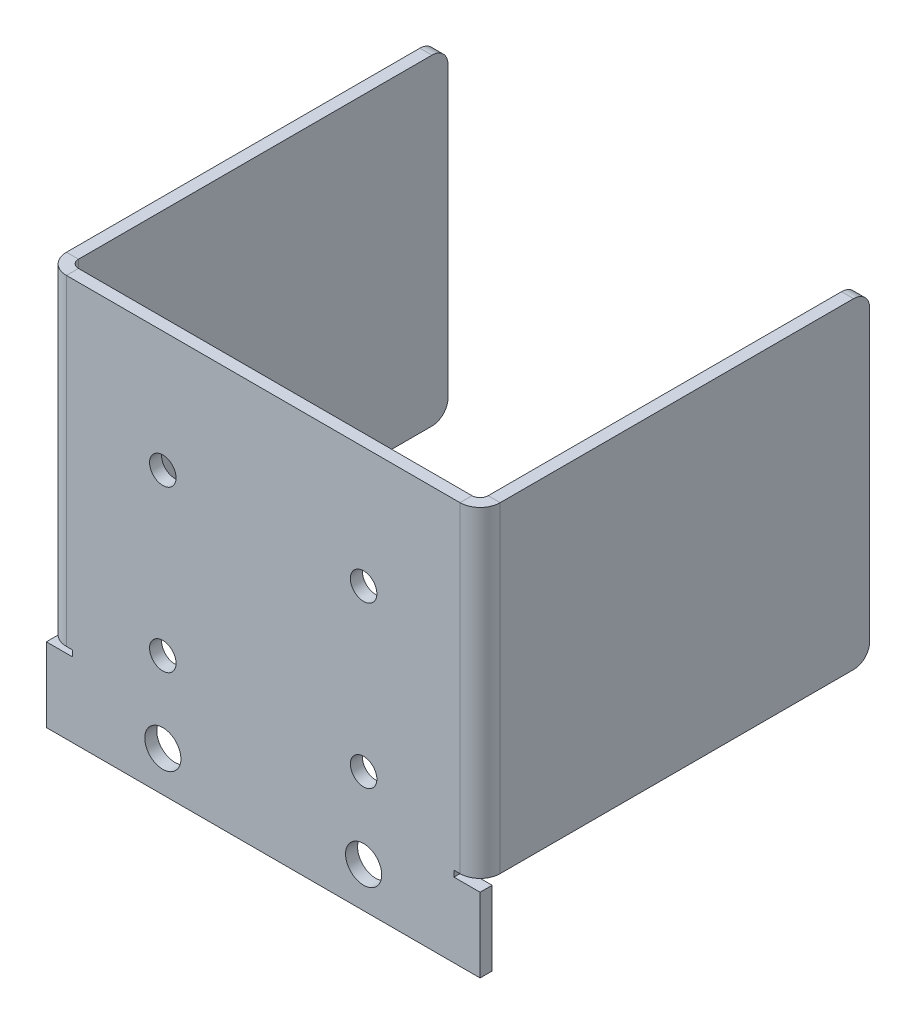
from build123d import *

# Parameters (mm, degrees)
SKETCH_1_W                          = 54
SKETCH_1_H                          = 50
SM_BASE_FLANGE_1_DEPTH              = 1.5
SM_EDGE_FLANGE_1_STRIP_W            = 8
SM_EDGE_FLANGE_1_STRIP_H            = 1.5
SM_EDGE_FLANGE_1_STRIP_CUT_DEPTH    = 40
SM_EDGE_FLANGE_1_RELIEF_W           = 8.75
SM_EDGE_FLANGE_1_RELIEF_H           = 0.75
SM_EDGE_FLANGE_1_RELIEF_CUT_DEPTH   = 1.5
SM_EDGE_FLANGE_1_STRIP_2_W          = 8
SM_EDGE_FLANGE_1_STRIP_2_H          = 1.5
SM_EDGE_FLANGE_1_STRIP_CUT_2_DEPTH  = 40
SM_EDGE_FLANGE_1_RELIEF_2_W         = 8.75
SM_EDGE_FLANGE_1_RELIEF_2_H         = 0.75
SM_EDGE_FLANGE_1_RELIEF_CUT_2_DEPTH = 1.5
SM_EDGE_FLANGE_1_DEPTH              = 40
SM_EDGE_FLANGE_1_BEND_DEPTH         = 40
HOLE_WIZARD_M4_1_D                  = 4.5
HOLE_WIZARD_M4_1_2_D                = 3.3
HOLE_WIZARD_M4_1_3_D                = 3.3
OTHER_START                         = -27
OTHER_1_DEPTH                       = 54


# Read off the part's stored shape, not the designer's step: 断开-边角1
# Sheet-metal steps are written as plain solids
with BuildPart() as part:
    # Sketch 1 → 基体-法兰1 (new body)
    with BuildSketch(Plane.XY):
        Rectangle(SKETCH_1_W, SKETCH_1_H)
    extrude(amount=-SM_BASE_FLANGE_1_DEPTH)

    # 边线-法兰1 strip (across the edge) → 边线-法兰1 strip cut (cut)
    with BuildSketch(Plane(origin=(27, 25, -1.5), x_dir=(-1, 0, 0), z_dir=(0, -1, 0))):
        with Locations((-1.5, -0.75)):
            Rectangle(SM_EDGE_FLANGE_1_STRIP_W, SM_EDGE_FLANGE_1_STRIP_H)
    extrude(amount=SM_EDGE_FLANGE_1_STRIP_CUT_DEPTH, mode=Mode.SUBTRACT)

    # 边线-法兰1 relief (on the sheet) → 边线-法兰1 relief cut (cut)
    with BuildSketch(Plane(origin=(24.5, 25, -1.5), x_dir=(-1, 0, 0), z_dir=(0, 0, -1))):
        with Locations((-3.625, -40.375)):
            Rectangle(SM_EDGE_FLANGE_1_RELIEF_W, SM_EDGE_FLANGE_1_RELIEF_H)
    extrude(amount=-SM_EDGE_FLANGE_1_RELIEF_CUT_DEPTH, mode=Mode.SUBTRACT)

    # 边线-法兰1 strip 2 (across the edge) → 边线-法兰1 strip cut 2 (cut)
    with BuildSketch(Plane(origin=(-27, -15, -1.5), x_dir=(1, 0, 0), z_dir=(0, 1, 0))):
        with Locations((-1.5, -0.75)):
            Rectangle(SM_EDGE_FLANGE_1_STRIP_2_W, SM_EDGE_FLANGE_1_STRIP_2_H)
    extrude(amount=SM_EDGE_FLANGE_1_STRIP_CUT_2_DEPTH, mode=Mode.SUBTRACT)

    # 边线-法兰1 relief 2 (on the sheet) → 边线-法兰1 relief cut 2 (cut)
    with BuildSketch(Plane(origin=(-24.5, -15, -1.5), x_dir=(1, 0, 0), z_dir=(0, 0, -1))):
        with Locations((-3.625, 0.375)):
            Rectangle(SM_EDGE_FLANGE_1_RELIEF_2_W, SM_EDGE_FLANGE_1_RELIEF_2_H)
    extrude(amount=-SM_EDGE_FLANGE_1_RELIEF_CUT_2_DEPTH, mode=Mode.SUBTRACT)

    # 边线-法兰1 section (across the edge) → 边线-法兰1 (add)
    with BuildSketch(Plane(origin=(27, 25, -1.5), x_dir=(-1, 0, 0), z_dir=(0, -1, 0))):
        with BuildLine():
            Line((0, 1), (0, 47))
            Line((0, 47), (1.5, 47))
            Line((1.5, 47), (1.5, 1))
            ThreePointArc((1.5, 1), (1.792893219, 0.292893219), (2.5, 0))
            Line((2.5, 0), (2.5, -1.5))
            ThreePointArc((2.5, -1.5), (0.732233047, -0.767766953), (0, 1))
        make_face()
    extrude(amount=SM_EDGE_FLANGE_1_DEPTH)

    # 边线-法兰1 section 2 (across the edge) → 边线-法兰1 bend (add)
    with BuildSketch(Plane(origin=(-27, -15, -1.5), x_dir=(1, 0, 0), z_dir=(0, 1, 0))):
        with BuildLine():
            Line((0, 1), (0, 47))
            Line((0, 47), (1.5, 47))
            Line((1.5, 47), (1.5, 1))
            ThreePointArc((1.5, 1), (1.792893219, 0.292893219), (2.5, 0))
            Line((2.5, 0), (2.5, -1.5))
            ThreePointArc((2.5, -1.5), (0.732233047, -0.767766953), (0, 1))
        make_face()
    extrude(amount=SM_EDGE_FLANGE_1_BEND_DEPTH)

    # Hole Wizard M4 _1 (through all)
    with Locations(Plane.XY):
        with Locations((-12.5, -20), (12.5, -20)):
            Hole(HOLE_WIZARD_M4_1_D / 2)

    # Hole Wizard M4 _1 2 (through all)
    with Locations(Plane(origin=(0, 0, -1.5), x_dir=(-1, 0, 0), z_dir=(0, 0, -1))):
        with Locations((-12.5, 10), (12.5, 10)):
            Hole(HOLE_WIZARD_M4_1_2_D / 2)

    # Hole Wizard M4 _1 3 (through all)
    with Locations(Plane.XY):
        with Locations((-12.5, -10), (12.5, -10)):
            Hole(HOLE_WIZARD_M4_1_3_D / 2)

    # Other 1 outline → Other 1 (cut)
    with BuildSketch(Plane.YZ.offset(OTHER_START)):
        with BuildLine():
            Line((-15, -48.5), (-13, -48.5))
            ThreePointArc((-13, -48.5), (-14.414213562, -47.914213562), (-15, -46.5))
            Line((-15, -46.5), (-15, -48.5))
        make_face()
        with BuildLine():
            ThreePointArc((25, -46.5), (24.414213562, -47.914213562), (23, -48.5))
            Line((23, -48.5), (25, -48.5))
            Line((25, -48.5), (25, -46.5))
        make_face()
    extrude(amount=OTHER_1_DEPTH, mode=Mode.SUBTRACT)


solid = part.part
